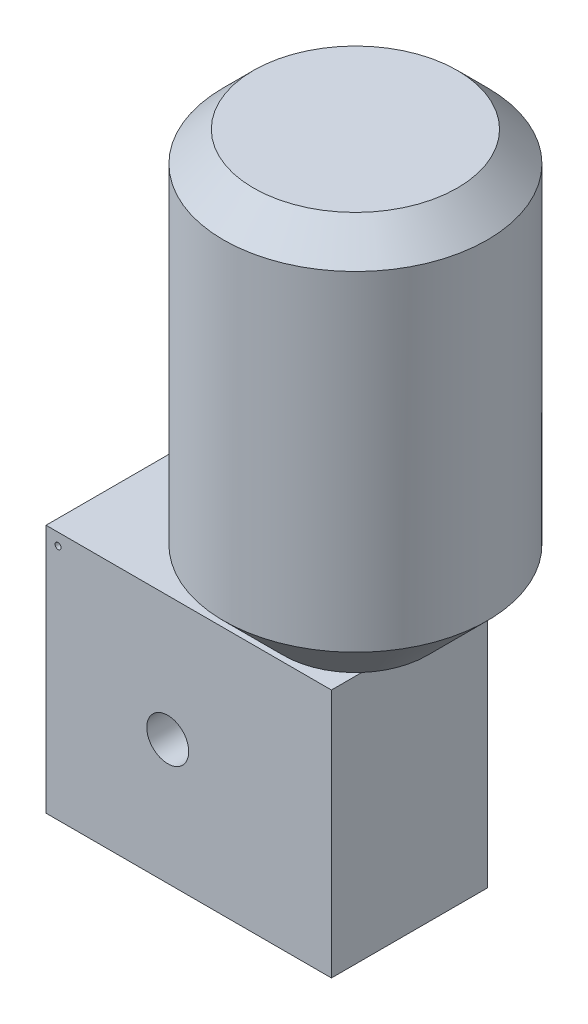
from build123d import *

# Parameters (mm, degrees)
SKETCH1_W           = 238
SKETCH1_H           = 208
SKETCH1_R           = 17.5
SKETCH1_R_2         = 2.5
BOSS_EXTRUDE1_DEPTH = 130


with BuildPart() as part:
    # Sketch1 → Boss-Extrude1 (new body)
    with BuildSketch(Plane.XY):
        with Locations((154, 104)):
            Rectangle(SKETCH1_W, SKETCH1_H)
        with Locations((136.5, 104)):
            Circle(SKETCH1_R, mode=Mode.SUBTRACT)
        with Locations((45, 198)):
            Circle(SKETCH1_R_2, mode=Mode.SUBTRACT)
    extrude(amount=-BOSS_EXTRUDE1_DEPTH)

    # Sketch2 → Revolve1 (revolve)
    with BuildSketch(Plane.XY.offset(-65)):
        Polygon((288, 208), (338, 258), (338, 533), (313, 558), (228, 558), (228, 208), align=None)
    revolve(axis=Axis((228, 157.831191951, -65), (0, 1, 0)))


solid = part.part
